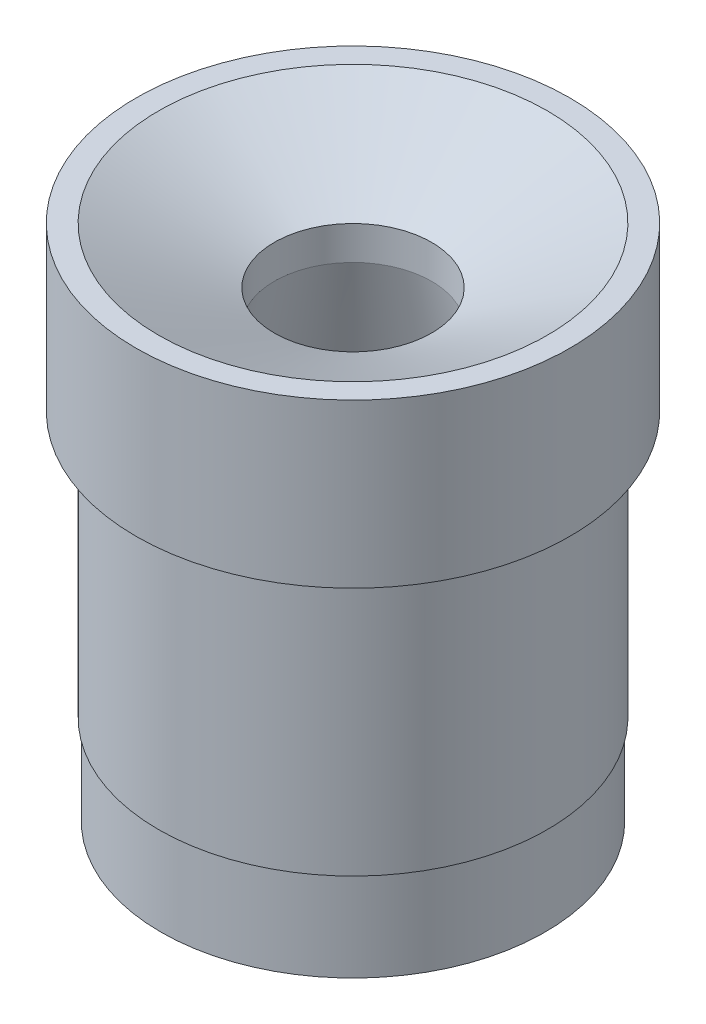
from build123d import *


with BuildPart() as part:
    # Sketch4 → Revolve1 (revolve)
    with BuildSketch(Plane(origin=(0, 0, 0), x_dir=(0, 0, -1), z_dir=(1, 0, 0))):
        Polygon((24.511, 0), (24.511, 18.415), (21.971, 18.415), (8.89, 12.086574371), (8.89, 8.276574371), (20.066, -40.132), (21.717, -40.132), (21.717, -29.972), (21.971, -29.972), (21.971, 0), align=None)
    revolve(axis=Axis((0, 21.55825, 0), (0, -1, 0)))


solid = part.part
